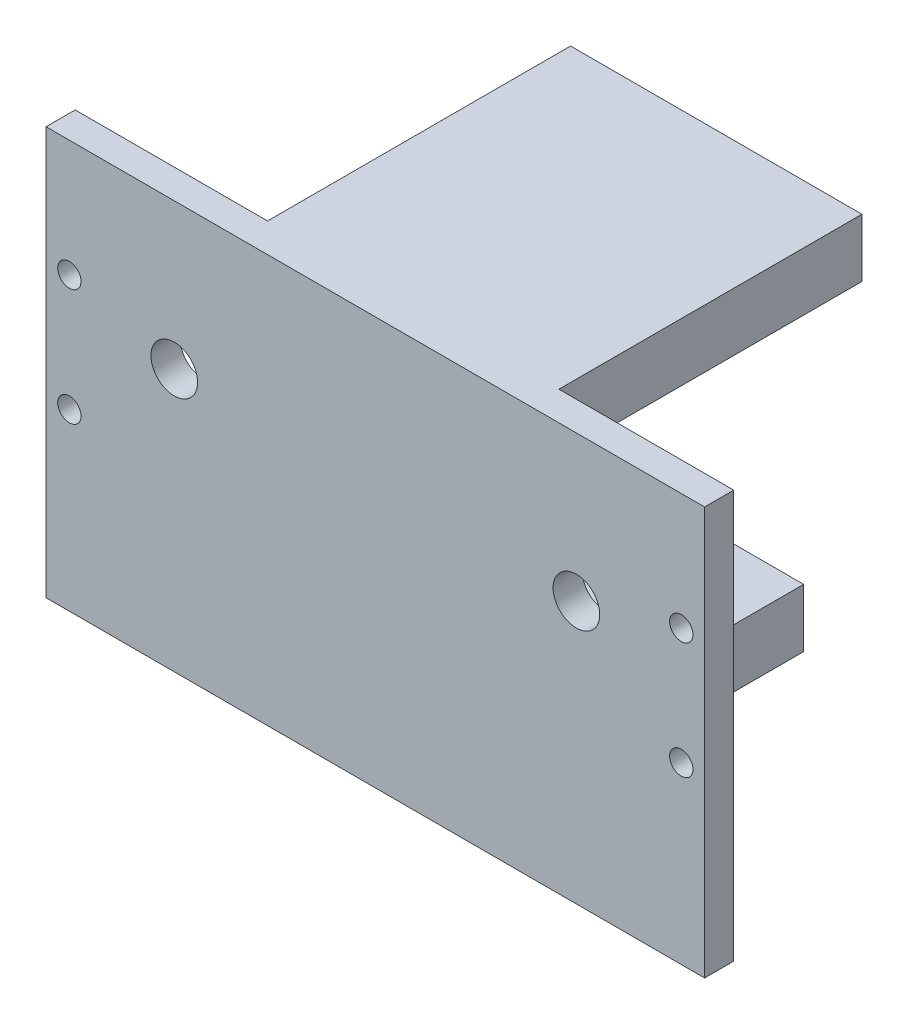
from build123d import *

# Parameters (mm, degrees)
SKETCH_1_W          = 113
SKETCH_1_H          = 70
EXTRUDE_1_DEPTH     = 5
SKETCH_2_W          = 30
SKETCH_2_H          = 10
SKETCH_2_W_2        = 50
EXTRUDE_2_DEPTH     = 52
SKETCH_3_R          = 4
CUT_EXTRUDE_1_DEPTH = 85.387499074
SKETCH_5_R          = 2
CUT_EXTRUDE_2_DEPTH = 88.55712421


with BuildPart() as part:
    # 草图1 → 凸台-拉伸1 (new body)
    with BuildSketch(Plane.XY):
        Rectangle(SKETCH_1_W, SKETCH_1_H)
    extrude(amount=EXTRUDE_1_DEPTH)

    # 草图2 → 凸台-拉伸2 (add)
    with BuildSketch(Plane(origin=(0, 0, 0), x_dir=(-1, 0, 0), z_dir=(0, 0, -1))):
        with Locations((-1.5, -30)):
            Rectangle(SKETCH_2_W, SKETCH_2_H)
        with Locations((-1.5, 30)):
            Rectangle(SKETCH_2_W_2, SKETCH_2_H)
    extrude(amount=EXTRUDE_2_DEPTH)

    # 草图3 → 切除-拉伸1 (cut, through all)
    with BuildSketch(Plane(origin=(0, 0, 0), x_dir=(-1, 0, 0), z_dir=(0, 0, -1))):
        with Locations((-34.5, 10)):
            Circle(SKETCH_3_R)
        with Locations((34.5, 10)):
            Circle(SKETCH_3_R)
    extrude(amount=-CUT_EXTRUDE_1_DEPTH, mode=Mode.SUBTRACT)

    # 草图5 → 切除-拉伸2 (cut, through all)
    with BuildSketch(Plane.XY.offset(5)):
        with Locations((-52.5, 15)):
            Circle(SKETCH_5_R)
        with Locations((52.5, 15)):
            Circle(SKETCH_5_R)
        with Locations((52.5, -5)):
            Circle(SKETCH_5_R)
        with Locations((-52.5, -5)):
            Circle(SKETCH_5_R)
    extrude(amount=-CUT_EXTRUDE_2_DEPTH, mode=Mode.SUBTRACT)


solid = part.part
